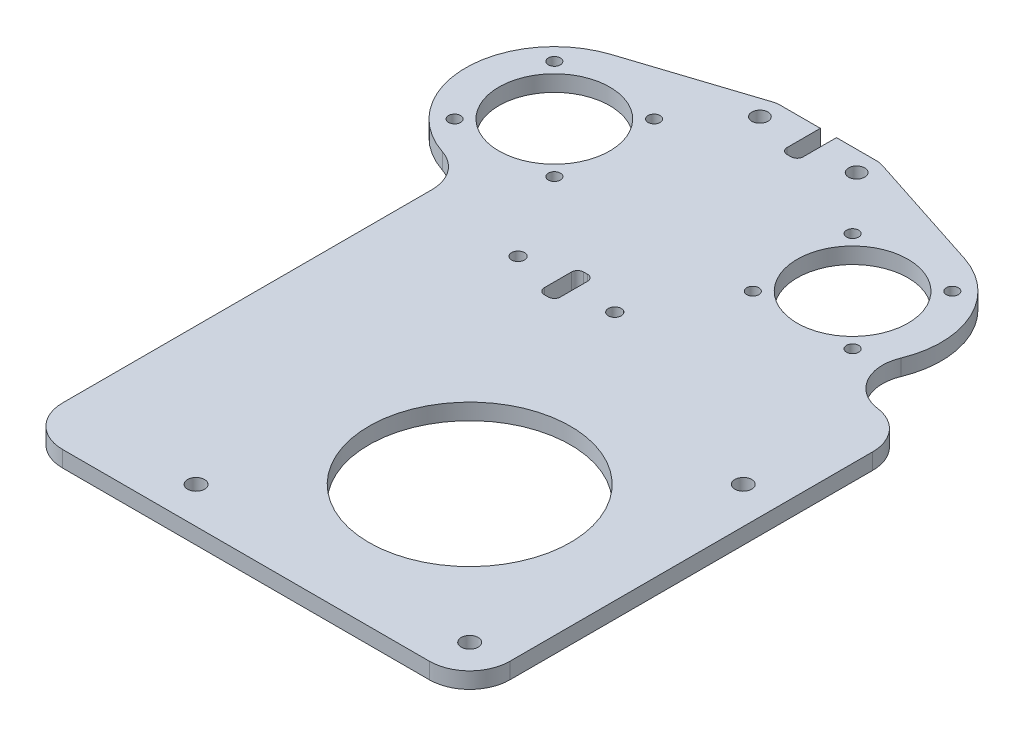
from build123d import *

# Parameters (mm, degrees)
SKETCH_1_R          = 2
SKETCH_1_R_2        = 1.5
SKETCH_1_R_3        = 13.75
EXTRUDE_1_DEPTH     = 4
SKETCH1_W           = 111
SKETCH1_H           = 110
SKETCH1_R           = 1.6
SKETCH1_R_2         = 2.1
SKETCH1_R_3         = 25
BOSS_EXTRUDE1_DEPTH = 4
FILLET1_R           = 10
FILLET2_DEPTH       = 4
CUT_EXTRUDE1_DEPTH  = 10


with BuildPart() as part:
    # 草图1 → 凸台-拉伸1 (new body)
    with BuildSketch(Plane(origin=(0, 0, 0), x_dir=(1, 0, 0), z_dir=(0, 1, 0))):
        with BuildLine():
            Line((-43.799718629, 20.922806374), (-13.545390598, 30.755183267))
            ThreePointArc((-13.545390598, 30.755183267), (-12.782331025, 30.938416565), (-12, 31))
            Line((-12, 31), (12, 31))
            ThreePointArc((12, 31), (12.782331025, 30.938416565), (13.545390598, 30.755183267))
            Line((13.545390598, 30.755183267), (43.799718629, 20.922806374))
            ThreePointArc((43.799718629, 20.922806374), (58.729032885, -3.442256511), (37, -22))
            Line((37, -22), (-37, -22))
            ThreePointArc((-37, -22), (-58.729032885, -3.442256511), (-43.799718629, 20.922806374))
        make_face()
        with Locations(Location((-12, 26, 0), (0, 0, 270))):
            Circle(SKETCH_1_R, mode=Mode.SUBTRACT)
        with Locations(Location((12, 26, 0), (0, 0, 270))):
            Circle(SKETCH_1_R, mode=Mode.SUBTRACT)
        with Locations(Location((49.374368671, 12.374368671, 0), (0, 0, 270))):
            Circle(SKETCH_1_R_2, mode=Mode.SUBTRACT)
        with Locations(Location((49.374368671, -12.374368671, 0), (0, 0, 270))):
            Circle(SKETCH_1_R_2, mode=Mode.SUBTRACT)
        with Locations(Location((24.625631329, -12.374368671, 0), (0, 0, 270))):
            Circle(SKETCH_1_R_2, mode=Mode.SUBTRACT)
        with Locations(Location((24.625631329, 12.374368671, 0), (0, 0, 270))):
            Circle(SKETCH_1_R_2, mode=Mode.SUBTRACT)
        with Locations(Location((-49.374368671, -12.374368671, 0), (0, 0, 90))):
            Circle(SKETCH_1_R_2, mode=Mode.SUBTRACT)
        with Locations(Location((-24.625631329, -12.374368671, 0), (0, 0, 90))):
            Circle(SKETCH_1_R_2, mode=Mode.SUBTRACT)
        with Locations(Location((-49.374368671, 12.374368671, 0), (0, 0, 90))):
            Circle(SKETCH_1_R_2, mode=Mode.SUBTRACT)
        with Locations(Location((-24.625631329, 12.374368671, 0), (0, 0, 90))):
            Circle(SKETCH_1_R_2, mode=Mode.SUBTRACT)
        with Locations(Location((-37, 0, 0), (0, 0, 270))):
            Circle(SKETCH_1_R_3, mode=Mode.SUBTRACT)
        with Locations(Location((37, 0, 0), (0, 0, 90))):
            Circle(SKETCH_1_R_3, mode=Mode.SUBTRACT)
    extrude(amount=EXTRUDE_1_DEPTH)

    # Sketch1 → Boss-Extrude1 (add)
    with BuildSketch(Plane(origin=(0, 4, 0), x_dir=(1, 0, 0), z_dir=(0, 1, 0))):
        with Locations((18.5, -77)):
            Rectangle(SKETCH1_W, SKETCH1_H)
        with Locations(Location((12, -34, 0), (0, 0, 270))):
            Circle(SKETCH1_R, mode=Mode.SUBTRACT)
        with Locations(Location((-12, -34, 0), (0, 0, 270))):
            Circle(SKETCH1_R, mode=Mode.SUBTRACT)
        with Locations(Location((-2.941125497, -122.941125497, 0), (0, 0, 270))):
            Circle(SKETCH1_R_2, mode=Mode.SUBTRACT)
        with Locations(Location((64.941125497, -122.941125497, 0), (0, 0, 270))):
            Circle(SKETCH1_R_2, mode=Mode.SUBTRACT)
        with Locations(Location((64.941125497, -55.058874503, 0), (0, 0, 270))):
            Circle(SKETCH1_R_2, mode=Mode.SUBTRACT)
        with Locations(Location((31, -89, 0), (0, 0, 270))):
            Circle(SKETCH1_R_3, mode=Mode.SUBTRACT)
    extrude(amount=-BOSS_EXTRUDE1_DEPTH)

    # Fillet1
    fillet1_edges = [part.edges().sort_by_distance(p)[0] for p in [
        (-37, 2, 22),
        (-37, 2, 132),
        (74, 2, 22),
        (74, 2, 132),
    ]]
    fillet(fillet1_edges, radius=FILLET1_R)

    # Fillet2: read off the stored shape, not the designer's step
    # Fillet2 outline → Fillet2 (add)
    with BuildSketch(Plane(origin=(0, 0, 0), x_dir=(1, 0, 0), z_dir=(0, 1, 0))):
        with BuildLine():
            ThreePointArc((65.297899409, -22.084584874), (57.943895671, -17.183606101), (57.347111687, -8.366304201))
            ThreePointArc((57.347111687, -8.366304201), (49.246250601, -18.276469742), (37, -22))
            Line((37, -22), (64, -22))
            ThreePointArc((64, -22), (64.650326356, -22.021168624), (65.297899409, -22.084584874))
        make_face()
    extrude(amount=FILLET2_DEPTH)

    # Sketch2 → Cut-Extrude1 (cut)
    with BuildSketch(Plane(origin=(0, 4, 0), x_dir=(1, 0, 0), z_dir=(0, 1, 0))):
        with BuildLine():
            Line((-2, 31), (2, 31))
            Line((2, 31), (2, 22.743593539))
            ThreePointArc((2, 22.743593539), (1.560660172, 21.682933368), (0.5, 21.243593539))
            Line((0.5, 21.243593539), (-0.5, 21.243593539))
            ThreePointArc((-0.5, 21.243593539), (-1.560660172, 21.682933368), (-2, 22.743593539))
            Line((-2, 22.743593539), (-2, 31))
        make_face()
        with BuildLine():
            Line((-0.5, -29.243593539), (0.5, -29.243593539))
            ThreePointArc((0.5, -29.243593539), (1.560660172, -29.682933368), (2, -30.743593539))
            Line((2, -30.743593539), (2, -37.5))
            ThreePointArc((2, -37.5), (1.560660172, -38.560660172), (0.5, -39))
            Line((0.5, -39), (-0.5, -39))
            ThreePointArc((-0.5, -39), (-1.560660172, -38.560660172), (-2, -37.5))
            Line((-2, -37.5), (-2, -30.743593539))
            ThreePointArc((-2, -30.743593539), (-1.560660172, -29.682933368), (-0.5, -29.243593539))
        make_face()
    extrude(amount=-CUT_EXTRUDE1_DEPTH, mode=Mode.SUBTRACT)


solid = part.part
